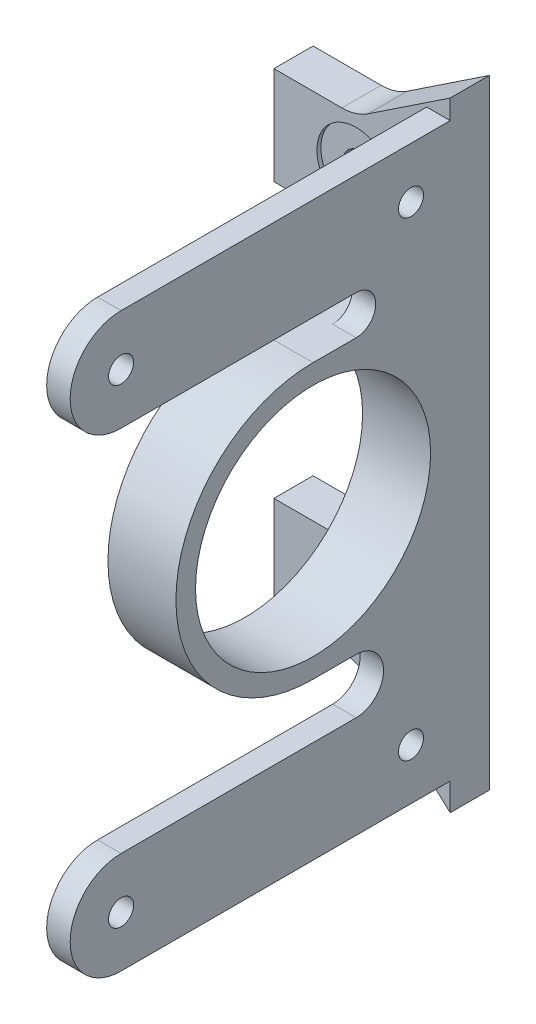
from build123d import *

# Parameters (mm, degrees)
SKETCH_2_W                     = 45
SKETCH_2_H                     = 60
SKETCH_2_W_2                   = 27.647058823
SKETCH_2_H_2                   = 35
EXTRUDE_2_DEPTH                = 5
SKETCH_4_W                     = 8.676470589
SKETCH_4_H                     = 35
SKETCH_4_W_2                   = 8.676470588
EXTRUDE_15_DEPTH               = 35
CUT_EXTRUDE_1_DEPTH            = 45
SKETCH_6_R                     = 15
CUT_EXTRUDE_2_DEPTH            = 45
FILLET_1_R                     = 5
EXTRUDE_START                  = -1
SKETCH_7_R                     = 15
SKETCH_7_R_2                   = 13
EXTRUDE_16_DEPTH               = 1
SPLIT_BODIES_1_SURFACE_1_BACK  = 86
SPLIT_BODIES_1_SURFACE_1_DEPTH = 172
SPLIT_BODIES_1_SURFACE_2_BACK  = 86
SPLIT_BODIES_1_SURFACE_2_DEPTH = 172
SKETCH_17_W                    = 3
SKETCH_17_H                    = 13
EXTRUDE_20_DEPTH               = 42
EXTRUDE_21_DEPTH               = 3
SKETCH_19_R                    = 1.6
CUT_EXTRUDE_3_DEPTH            = 3
EXTRUDE_22_DEPTH               = 5
EXTRUDE_25_DEPTH               = 3
HOLE_WIZARD_1_D                = 4.3
HOLE_WIZARD_1_DEPTH            = 5
HOLE_WIZARD_1_CBORE_D          = 10
HOLE_WIZARD_1_CBORE_DEPTH      = 0.5
HOLE_WIZARD_1_TIP              = 1.291850331
FILLET_2_R                     = 6


with BuildPart() as part:
    # 草图2 → 凸台-拉伸2 (new body)
    with BuildSketch(Plane.XY):
        with Locations((7.726423565, -5.661764706)):
            Rectangle(SKETCH_2_W, SKETCH_2_H)
        with Locations((7.726423565, -5.661764706)):
            Rectangle(SKETCH_2_W_2, SKETCH_2_H_2, mode=Mode.SUBTRACT)
    extrude(amount=EXTRUDE_2_DEPTH)

    # 草图4 → 凸台-拉伸15 (add)
    with BuildSketch(Plane.XY.offset(5)):
        with Locations((-10.435341141, -5.661764706)):
            Rectangle(SKETCH_4_W, SKETCH_4_H)
        with Locations((25.888188271, -5.661764706)):
            Rectangle(SKETCH_4_W_2, SKETCH_4_H)
    extrude(amount=EXTRUDE_15_DEPTH)

    # 草图5 → 切除-拉伸1 (cut)
    with BuildSketch(Plane.ZY.offset(14.773576435)):
        with BuildLine():
            ThreePointArc((22.5, 11.838235294), (34.874368671, 6.712603965), (40, -5.661764706))
            Line((40, -5.661764706), (40, 11.838235294))
            Line((40, 11.838235294), (22.5, 11.838235294))
        make_face()
        with BuildLine():
            Line((40, -23.161764706), (40, -5.661764706))
            ThreePointArc((40, -5.661764706), (34.874368671, -18.036133377), (22.5, -23.161764706))
            Line((22.5, -23.161764706), (40, -23.161764706))
        make_face()
    extrude(amount=-CUT_EXTRUDE_1_DEPTH, mode=Mode.SUBTRACT)

    # 草图6 → 切除-拉伸2 (cut)
    with BuildSketch(Plane.ZY.offset(14.773576435)):
        with Locations((22.5, -5.661764706)):
            Circle(SKETCH_6_R)
    extrude(amount=-CUT_EXTRUDE_2_DEPTH, mode=Mode.SUBTRACT)

    # 圆角1
    fillet_1_edges = [part.edges().sort_by_distance(p)[0] for p in [
        (-6.097105846, 11.838235294, 2.5),
        (21.549952977, 11.838235294, 2.5),
        (-6.097105846, -23.161764706, 2.5),
        (21.549952977, -23.161764706, 2.5),
    ]]
    fillet(fillet_1_edges, radius=FILLET_1_R)

    # 草图7 → 凸台-拉伸16 (add)
    with BuildSketch(Plane(origin=(-6.097105846, 0, 0), x_dir=(0, 0, -1), z_dir=(1, 0, 0)).offset(EXTRUDE_START)):
        with Locations((-22.5, -5.661764706)):
            Circle(SKETCH_7_R)
        with Locations((-22.5, -5.661764706)):
            Circle(SKETCH_7_R_2, mode=Mode.SUBTRACT)
    extrude(amount=EXTRUDE_16_DEPTH)


with BuildPart() as body_2:
    # Split Bodies 1: the piece behind the surface
    add(part.part)
    # Split Bodies 1 surface: a surface, the sketch's curves swept straight by 172 mm
    with BuildLine(Plane.XY.offset(5).offset(-SPLIT_BODIES_1_SURFACE_1_BACK), mode=Mode.PRIVATE) as split_bodies_1_surface_1_path:
        Line((7.726423565, 24.338235294), (7.726423565, -35.661764706))
    split_bodies_1_surface_1 = Shell.extrude(split_bodies_1_surface_1_path.wire(), (0 * SPLIT_BODIES_1_SURFACE_1_DEPTH, 0 * SPLIT_BODIES_1_SURFACE_1_DEPTH, 1 * SPLIT_BODIES_1_SURFACE_1_DEPTH))
    split(bisect_by=split_bodies_1_surface_1, keep=Keep.BOTTOM)


with BuildPart() as part_1:
    add(part.part)

    # Split Bodies 1: split by a surface, the side it looks to stays
    # Split Bodies 1 surface: a surface, the sketch's curves swept straight by 172 mm
    with BuildLine(Plane.XY.offset(5).offset(-SPLIT_BODIES_1_SURFACE_2_BACK), mode=Mode.PRIVATE) as split_bodies_1_surface_2_path:
        Line((7.726423565, 24.338235294), (7.726423565, -35.661764706))
    split_bodies_1_surface_2 = Shell.extrude(split_bodies_1_surface_2_path.wire(), (0 * SPLIT_BODIES_1_SURFACE_2_DEPTH, 0 * SPLIT_BODIES_1_SURFACE_2_DEPTH, 1 * SPLIT_BODIES_1_SURFACE_2_DEPTH))
    split(bisect_by=split_bodies_1_surface_2, keep=Keep.TOP)

    # 草图17 → 凸台-拉伸20 (add)
    with BuildSketch(Plane.XY.offset(5)):
        with Locations((28.726423565, -36.661764706)):
            Rectangle(SKETCH_17_W, SKETCH_17_H)
        with Locations((28.726423565, 23.338235294)):
            Rectangle(SKETCH_17_W, SKETCH_17_H)
    extrude(amount=EXTRUDE_20_DEPTH)

    # 草图18 → 凸台-拉伸21 (add)
    with BuildSketch(Plane(origin=(30.226423565, 0, 0), x_dir=(0, 0, -1), z_dir=(1, 0, 0))):
        with BuildLine():
            Line((-47, -30.161764706), (-47, -43.161764706))
            ThreePointArc((-47, -43.161764706), (-53.5, -36.661764706), (-47, -30.161764706))
        make_face()
        with BuildLine():
            Line((-47, 16.838235294), (-47, 29.838235294))
            ThreePointArc((-47, 29.838235294), (-53.5, 23.338235294), (-47, 16.838235294))
        make_face()
    extrude(amount=-EXTRUDE_21_DEPTH)

    # 草图19 → 切除-拉伸3 (cut)
    with BuildSketch(Plane(origin=(30.226423565, 0, 0), x_dir=(0, 0, -1), z_dir=(1, 0, 0))):
        with Locations((-47, 23.338235294)):
            Circle(SKETCH_19_R)
        with Locations((-47, -36.661764706)):
            Circle(SKETCH_19_R)
        with Locations((-10, 23.338235294)):
            Circle(SKETCH_19_R)
        with Locations((-10, -36.661764706)):
            Circle(SKETCH_19_R)
    extrude(amount=-CUT_EXTRUDE_3_DEPTH, mode=Mode.SUBTRACT)

    # 草图21 → 凸台-拉伸22 (add)
    with BuildSketch(Plane.XY.offset(5)):
        Polygon((18.226423565, -35.661764706), (30.226423565, -35.661764706), (30.226423565, -46.661764706), align=None)
        Polygon((18.226423565, 24.338235294), (30.226423565, 24.338235294), (30.226423565, 32.338235294), align=None)
    extrude(amount=-EXTRUDE_22_DEPTH)

    # 草图24 → 凸台-拉伸25 (add)
    with BuildSketch(Plane(origin=(30.226423565, 0, 0), x_dir=(0, 0, -1), z_dir=(1, 0, 0))):
        with BuildLine():
            Line((-17, -23.161764706), (-5, -23.161764706))
            Line((-5, -23.161764706), (-5, -30.161764706))
            Line((-5, -30.161764706), (-17, -30.161764706))
            ThreePointArc((-17, -30.161764706), (-13.5, -26.661764706), (-17, -23.161764706))
        make_face()
        with BuildLine():
            Line((-17, 11.838235294), (-5, 11.838235294))
            Line((-5, 11.838235294), (-5, 16.838235294))
            Line((-5, 16.838235294), (-17, 16.838235294))
            ThreePointArc((-17, 16.838235294), (-14.5, 14.338235294), (-17, 11.838235294))
        make_face()
    extrude(amount=-EXTRUDE_25_DEPTH)

    # 打孔尺寸(%根据六角头螺)栓 全螺纹的类型1
    with Locations(Plane(origin=(18.226423565, 18.088235294, 5), x_dir=(1, 0, 0), z_dir=(0, 0, 1))):
        with Locations((0, 0), (0, -47.5)):
            CounterBoreHole(HOLE_WIZARD_1_D / 2, HOLE_WIZARD_1_CBORE_D / 2, HOLE_WIZARD_1_CBORE_DEPTH, depth=HOLE_WIZARD_1_DEPTH)
            with Locations((0, 0, -(HOLE_WIZARD_1_DEPTH + HOLE_WIZARD_1_TIP / 2))):  # 118° drill point
                Cone(0, HOLE_WIZARD_1_D / 2, HOLE_WIZARD_1_TIP, mode=Mode.SUBTRACT)

    # 圆角2
    fillet_2_edges = [part_1.edges().sort_by_distance(p)[0] for p in [
        (18.226423565, -35.661764706, 2.5),
        (18.226423565, 24.338235294, 2.5),
    ]]
    fillet(fillet_2_edges, radius=FILLET_2_R)


solid = part_1.part
